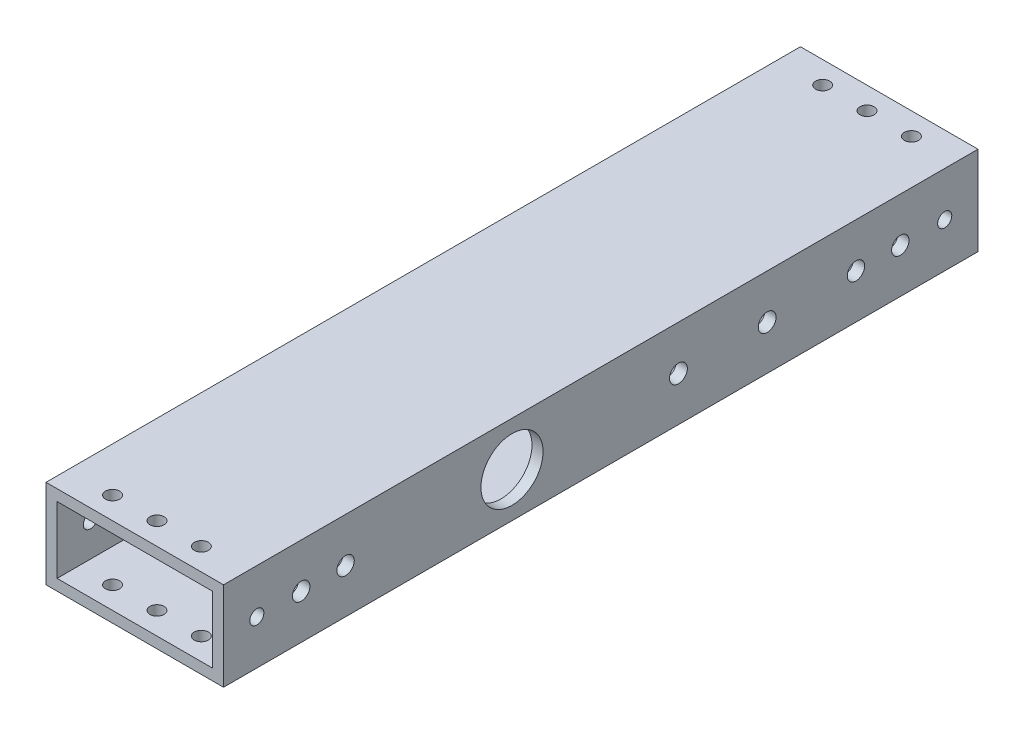
from build123d import *

# Parameters (mm, degrees)
SKETCH1_W           = 50.8
SKETCH1_H           = 25.4
SKETCH1_W_2         = 44.45
SKETCH1_H_2         = 19.05
BOSS_EXTRUDE1_DEPTH = 107.95
SKETCH2_R           = 2.0193
SKETCH2_R_2         = 2.4892
CUT_EXTRUDE1_DEPTH  = 120.979717036
SKETCH3_R           = 2.0193
CUT_EXTRUDE2_DEPTH  = 114.769602707
SKETCH4_R           = 8.89
SKETCH4_R_2         = 2.5527
CUT_EXTRUDE3_DEPTH  = 120.979717036
CUT_EXTRUDE4_REACH  = 115.77
SKETCH5_R           = 2.5527


with BuildPart() as part:
    # Sketch1 → Boss-Extrude1 (new, symmetric)
    with BuildSketch(Plane.XY):
        Rectangle(SKETCH1_W, SKETCH1_H)
        Rectangle(SKETCH1_W_2, SKETCH1_H_2, mode=Mode.SUBTRACT)
    extrude(amount=BOSS_EXTRUDE1_DEPTH, both=True)

    # Sketch2 → Cut-Extrude1 (cut, through all)
    with BuildSketch(Plane(origin=(25.4, 0, 0), x_dir=(0, 0, -1), z_dir=(1, 0, 0))):
        with Locations((-98.425, 0)):
            Circle(SKETCH2_R)
        with Locations((98.425, 0)):
            Circle(SKETCH2_R)
        with Locations((-85.725, 0)):
            Circle(SKETCH2_R_2)
        with Locations((-73.025, 0)):
            Circle(SKETCH2_R_2)
        with Locations((73.025, 0)):
            Circle(SKETCH2_R_2)
        with Locations((85.725, 0)):
            Circle(SKETCH2_R_2)
    extrude(amount=-CUT_EXTRUDE1_DEPTH, mode=Mode.SUBTRACT)

    # Sketch3 → Cut-Extrude2 (cut, through all)
    with BuildSketch(Plane(origin=(0, 12.7, 0), x_dir=(1, 0, 0), z_dir=(0, 1, 0))):
        with Locations((-12.7, -101.6)):
            Circle(SKETCH3_R)
        with Locations((0, -101.6)):
            Circle(SKETCH3_R)
        with Locations((12.7, -101.6)):
            Circle(SKETCH3_R)
        with Locations((12.7, 101.6)):
            Circle(SKETCH3_R)
        with Locations((0, 101.6)):
            Circle(SKETCH3_R)
        with Locations((-12.7, 101.6)):
            Circle(SKETCH3_R)
    extrude(amount=-CUT_EXTRUDE2_DEPTH, mode=Mode.SUBTRACT)

    # Sketch4 → Cut-Extrude3 (cut, through all)
    with BuildSketch(Plane(origin=(25.4, 0, 0), x_dir=(0, 0, -1), z_dir=(1, 0, 0))):
        with Locations((-25.4, 0)):
            Circle(SKETCH4_R)
        with Locations((47.625, 0)):
            Circle(SKETCH4_R_2)
        with Locations((22.225, 0)):
            Circle(SKETCH4_R_2)
    extrude(amount=-CUT_EXTRUDE3_DEPTH, mode=Mode.SUBTRACT)

    # Sketch5 → Cut-Extrude4 (cut, up to next)
    with BuildSketch(Plane.XZ.offset(12.7), mode=Mode.PRIVATE) as cut_extrude4_sk1:
        with Locations((-3.81, 69.85)):
            Circle(SKETCH5_R)
    cut_extrude4_tool1 = extrude(cut_extrude4_sk1.sketch, amount=-CUT_EXTRUDE4_REACH, mode=Mode.PRIVATE) & part.part
    # Sketch5 → Cut-Extrude4 (cut, up to next)
    with BuildSketch(Plane.XZ.offset(12.7), mode=Mode.PRIVATE) as cut_extrude4_sk2:
        with Locations((-16.51, 69.85)):
            Circle(SKETCH5_R)
    cut_extrude4_tool2 = extrude(cut_extrude4_sk2.sketch, amount=-CUT_EXTRUDE4_REACH, mode=Mode.PRIVATE) & part.part
    # Sketch5 → Cut-Extrude4 (cut, up to next)
    with BuildSketch(Plane.XZ.offset(12.7), mode=Mode.PRIVATE) as cut_extrude4_sk3:
        with Locations((-16.51, 57.15)):
            Circle(SKETCH5_R)
    cut_extrude4_tool3 = extrude(cut_extrude4_sk3.sketch, amount=-CUT_EXTRUDE4_REACH, mode=Mode.PRIVATE) & part.part
    # Sketch5 → Cut-Extrude4 (cut, up to next)
    with BuildSketch(Plane.XZ.offset(12.7), mode=Mode.PRIVATE) as cut_extrude4_sk4:
        with Locations((-3.81, 57.15)):
            Circle(SKETCH5_R)
    cut_extrude4_tool4 = extrude(cut_extrude4_sk4.sketch, amount=-CUT_EXTRUDE4_REACH, mode=Mode.PRIVATE) & part.part
    # Sketch5 → Cut-Extrude4 (cut, up to next)
    with BuildSketch(Plane.XZ.offset(12.7), mode=Mode.PRIVATE) as cut_extrude4_sk5:
        with Locations((-3.81, -6.35)):
            Circle(SKETCH5_R)
    cut_extrude4_tool5 = extrude(cut_extrude4_sk5.sketch, amount=-CUT_EXTRUDE4_REACH, mode=Mode.PRIVATE) & part.part
    # Sketch5 → Cut-Extrude4 (cut, up to next)
    with BuildSketch(Plane.XZ.offset(12.7), mode=Mode.PRIVATE) as cut_extrude4_sk6:
        with Locations((-16.51, -6.35)):
            Circle(SKETCH5_R)
    cut_extrude4_tool6 = extrude(cut_extrude4_sk6.sketch, amount=-CUT_EXTRUDE4_REACH, mode=Mode.PRIVATE) & part.part
    # Sketch5 → Cut-Extrude4 (cut, up to next)
    with BuildSketch(Plane.XZ.offset(12.7), mode=Mode.PRIVATE) as cut_extrude4_sk7:
        with Locations((-16.51, -19.05)):
            Circle(SKETCH5_R)
    cut_extrude4_tool7 = extrude(cut_extrude4_sk7.sketch, amount=-CUT_EXTRUDE4_REACH, mode=Mode.PRIVATE) & part.part
    # Sketch5 → Cut-Extrude4 (cut, up to next)
    with BuildSketch(Plane.XZ.offset(12.7), mode=Mode.PRIVATE) as cut_extrude4_sk8:
        with Locations((-3.81, -19.05)):
            Circle(SKETCH5_R)
    cut_extrude4_tool8 = extrude(cut_extrude4_sk8.sketch, amount=-CUT_EXTRUDE4_REACH, mode=Mode.PRIVATE) & part.part
    add(cut_extrude4_tool1.solids().sort_by_distance((-3.81, -12.7, 69.85))[0], mode=Mode.SUBTRACT)
    add(cut_extrude4_tool2.solids().sort_by_distance((-16.51, -12.7, 69.85))[0], mode=Mode.SUBTRACT)
    add(cut_extrude4_tool3.solids().sort_by_distance((-16.51, -12.7, 57.15))[0], mode=Mode.SUBTRACT)
    add(cut_extrude4_tool4.solids().sort_by_distance((-3.81, -12.7, 57.15))[0], mode=Mode.SUBTRACT)
    add(cut_extrude4_tool5.solids().sort_by_distance((-3.81, -12.7, -6.35))[0], mode=Mode.SUBTRACT)
    add(cut_extrude4_tool6.solids().sort_by_distance((-16.51, -12.7, -6.35))[0], mode=Mode.SUBTRACT)
    add(cut_extrude4_tool7.solids().sort_by_distance((-16.51, -12.7, -19.05))[0], mode=Mode.SUBTRACT)
    add(cut_extrude4_tool8.solids().sort_by_distance((-3.81, -12.7, -19.05))[0], mode=Mode.SUBTRACT)


solid = part.part
